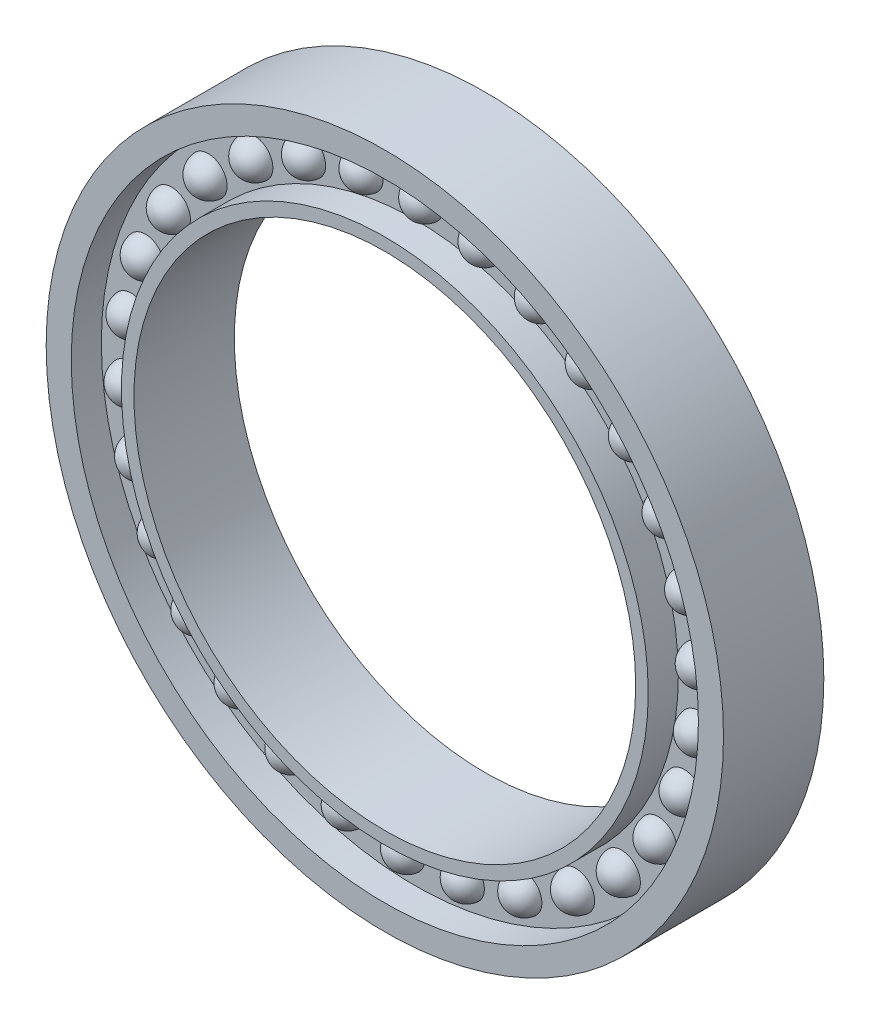
from build123d import *

# Parameters (mm, degrees)
SKETCH_1_R                       = 13.5
SKETCH_1_R_2                     = 10
EXTRUDE_1_DEPTH                  = 2
SKETCH_2_R                       = 12.5
SKETCH_2_R_2                     = 10.5
CUT_EXTRUDE_1_DEPTH              = 1.2
SKETCH_4_R                       = 0.75
EXTRUDE_2_DEPTH                  = 1.5
FILLET_1_R                       = 0.75
FILLET_2_R                       = 0.75
PATTERN_CIRCULAR_2_COUNT         = 30
FILLET_1_OF_PATTERN_CIRCULAR_2_R = 0.75
FILLET_2_OF_PATTERN_CIRCULAR_2_R = 0.75


with BuildPart() as part:
    # 草图1 → 凸台-拉伸1 (new, symmetric)
    with BuildSketch(Plane.XY):
        Circle(SKETCH_1_R)
        Circle(SKETCH_1_R_2, mode=Mode.SUBTRACT)
    extrude(amount=EXTRUDE_1_DEPTH, both=True)

    # 草图2 → 切除-拉伸1 (cut)
    with BuildSketch(Plane.XY.offset(2)):
        Circle(SKETCH_2_R)
        Circle(SKETCH_2_R_2, mode=Mode.SUBTRACT)
    cut_extrude_1 = extrude(amount=-CUT_EXTRUDE_1_DEPTH, mode=Mode.SUBTRACT)

    # 镜向1: 切除-拉伸1 across plane
    add(cut_extrude_1.mirror(Plane.XY), mode=Mode.SUBTRACT)

    # 草图4 → 凸台-拉伸2 (add, symmetric)
    with BuildSketch(Plane.XY):
        with Locations(Location((0.362190159, 11.409269929, 0), (0, 0, 180))):
            Circle(SKETCH_4_R)
    extrude_2 = extrude(amount=EXTRUDE_2_DEPTH, both=True)

    # 圆角1
    # the kernel refuses this fillet: 0.75 mm, written as the material it takes off along each edge
    with BuildSketch(Plane(origin=(0.362190159, 11.409269929, 1.5), x_dir=(-1, 0, 0), z_dir=(0, 1, 0))) as fillet_1_piece_1:
        with BuildLine():
            CenterArc((0.001668523, -0.75), FILLET_1_R, 3.822553729, 86.177446271)
            Line((0.001668523, 0), (0.001668523, 0.015))
            Line((0.001668523, 0.015), (0.75, 0.015))
            Line((0.75, 0.015), (0.765, 0))
            ThreePointArc((0.765, 0), (0.765, -0.35), (0.76496663, -0.699))
            Line((0.76496663, -0.699), (0.75, -0.7))
        make_face()
    revolve(axis=Axis((0.362190159, 11.409269929, 1.5), (0, 0, 1)), mode=Mode.SUBTRACT)

    # 圆角2
    # the kernel refuses this fillet: 0.75 mm, written as the material it takes off along each edge
    with BuildSketch(Plane(origin=(0.362190159, 11.409269929, -1.5), x_dir=(-1, 0, 0), z_dir=(0, 1, 0))) as fillet_2_piece_1:
        with BuildLine():
            CenterArc((0.001668523, 0.75), FILLET_2_R, 270, 86.177446271)
            Line((0.001668523, 0), (0.001668523, -0.015))
            Line((0.001668523, -0.015), (0.75, -0.015))
            Line((0.75, -0.015), (0.765, 0))
            ThreePointArc((0.765, 0), (0.765, 0.35), (0.76496663, 0.699))
            Line((0.76496663, 0.699), (0.75, 0.7))
        make_face()
    revolve(axis=Axis((0.362190159, 11.409269929, -1.5), (0, 0, 1)), mode=Mode.SUBTRACT)

    # 阵列(圆周)2: 凸台-拉伸2 ×30 about axis
    pattern_circular_2_axis = Axis((0, 0, 0), (0, 0, 1))
    for i in range(1, PATTERN_CIRCULAR_2_COUNT):
        add(extrude_2.rotate(pattern_circular_2_axis, i * 360 / PATTERN_CIRCULAR_2_COUNT))

    # 圆角1 of 阵列(圆周)2
    # the kernel refuses this fillet: 0.75 mm, written as the material it takes off along each edge
    with BuildSketch(Plane(origin=(-2.017845167, 11.235253576, 1.5), x_dir=(-0.9781476007338056, -0.20791169081775945, 0), z_dir=(-0.20791169081775945, 0.9781476007338056, 0))) as fillet_1_of_pattern_circular_2_piece_1:
        with BuildLine():
            CenterArc((0.001668523, -0.75), FILLET_1_OF_PATTERN_CIRCULAR_2_R, 3.822553729, 86.177446271)
            Line((0.001668523, 0), (0.001668523, 0.015))
            Line((0.001668523, 0.015), (0.75, 0.015))
            Line((0.75, 0.015), (0.765, 0))
            ThreePointArc((0.765, 0), (0.765, -0.35), (0.76496663, -0.699))
            Line((0.76496663, -0.699), (0.75, -0.7))
        make_face()
    revolve(axis=Axis((-2.017845167, 11.235253576, 1.5), (0, 0, 1)), mode=Mode.SUBTRACT)
    with BuildSketch(Plane(origin=(-4.309690977, 10.570202728, 1.5), x_dir=(-0.9135454576426008, -0.4067366430758004, 0), z_dir=(-0.4067366430758004, 0.9135454576426008, 0))) as fillet_1_of_pattern_circular_2_piece_2:
        with BuildLine():
            CenterArc((0.001668523, -0.75), FILLET_1_OF_PATTERN_CIRCULAR_2_R, 3.822553729, 86.177446271)
            Line((0.001668523, 0), (0.001668523, 0.015))
            Line((0.001668523, 0.015), (0.75, 0.015))
            Line((0.75, 0.015), (0.765, 0))
            ThreePointArc((0.765, 0), (0.765, -0.35), (0.76496663, -0.699))
            Line((0.76496663, -0.699), (0.75, -0.7))
        make_face()
    revolve(axis=Axis((-4.309690977, 10.570202728, 1.5), (0, 0, 1)), mode=Mode.SUBTRACT)
    with BuildSketch(Plane(origin=(-6.41318261, 9.4431833, 1.5), x_dir=(-0.809016994374948, -0.5877852522924724, 0), z_dir=(-0.5877852522924724, 0.809016994374948, 0))) as fillet_1_of_pattern_circular_2_piece_3:
        with BuildLine():
            CenterArc((0.001668523, -0.75), FILLET_1_OF_PATTERN_CIRCULAR_2_R, 3.822553729, 86.177446271)
            Line((0.001668523, 0), (0.001668523, 0.015))
            Line((0.001668523, 0.015), (0.75, 0.015))
            Line((0.75, 0.015), (0.765, 0))
            ThreePointArc((0.765, 0), (0.765, -0.35), (0.76496663, -0.699))
            Line((0.76496663, -0.699), (0.75, -0.7))
        make_face()
    revolve(axis=Axis((-6.41318261, 9.4431833, 1.5), (0, 0, 1)), mode=Mode.SUBTRACT)
    with BuildSketch(Plane(origin=(-8.23638739, 7.903451448, 1.5), x_dir=(-0.6691306063588581, -0.7431448254773942, 0), z_dir=(-0.7431448254773942, 0.6691306063588581, 0))) as fillet_1_of_pattern_circular_2_piece_4:
        with BuildLine():
            CenterArc((0.001668523, -0.75), FILLET_1_OF_PATTERN_CIRCULAR_2_R, 3.822553729, 86.177446271)
            Line((0.001668523, 0), (0.001668523, 0.015))
            Line((0.001668523, 0.015), (0.75, 0.015))
            Line((0.75, 0.015), (0.765, 0))
            ThreePointArc((0.765, 0), (0.765, -0.35), (0.76496663, -0.699))
            Line((0.76496663, -0.699), (0.75, -0.7))
        make_face()
    revolve(axis=Axis((-8.23638739, 7.903451448, 1.5), (0, 0, 1)), mode=Mode.SUBTRACT)
    with BuildSketch(Plane(origin=(-9.699622518, 6.018300843, 1.5), x_dir=(-0.5, -0.8660254037844387, 0), z_dir=(-0.8660254037844387, 0.5, 0))) as fillet_1_of_pattern_circular_2_piece_5:
        with BuildLine():
            CenterArc((0.001668523, -0.75), FILLET_1_OF_PATTERN_CIRCULAR_2_R, 3.822553729, 86.177446271)
            Line((0.001668523, 0), (0.001668523, 0.015))
            Line((0.001668523, 0.015), (0.75, 0.015))
            Line((0.75, 0.015), (0.765, 0))
            ThreePointArc((0.765, 0), (0.765, -0.35), (0.76496663, -0.699))
            Line((0.76496663, -0.699), (0.75, -0.7))
        make_face()
    revolve(axis=Axis((-9.699622518, 6.018300843, 1.5), (0, 0, 1)), mode=Mode.SUBTRACT)
    with BuildSketch(Plane(origin=(-10.738937598, 3.870121612, 1.5), x_dir=(-0.30901699437494773, -0.9510565162951535, 0), z_dir=(-0.9510565162951535, 0.30901699437494773, 0))) as fillet_1_of_pattern_circular_2_piece_6:
        with BuildLine():
            CenterArc((0.001668523, -0.75), FILLET_1_OF_PATTERN_CIRCULAR_2_R, 3.822553729, 86.177446271)
            Line((0.001668523, 0), (0.001668523, 0.015))
            Line((0.001668523, 0.015), (0.75, 0.015))
            Line((0.75, 0.015), (0.765, 0))
            ThreePointArc((0.765, 0), (0.765, -0.35), (0.76496663, -0.699))
            Line((0.76496663, -0.699), (0.75, -0.7))
        make_face()
    revolve(axis=Axis((-10.738937598, 3.870121612, 1.5), (0, 0, 1)), mode=Mode.SUBTRACT)
    with BuildSketch(Plane(origin=(-11.308909574, 1.552799496, 1.5), x_dir=(-0.10452846326765311, -0.9945218953682734, 0), z_dir=(-0.9945218953682734, 0.10452846326765311, 0))) as fillet_1_of_pattern_circular_2_piece_7:
        with BuildLine():
            CenterArc((0.001668523, -0.75), FILLET_1_OF_PATTERN_CIRCULAR_2_R, 3.822553729, 86.177446271)
            Line((0.001668523, 0), (0.001668523, 0.015))
            Line((0.001668523, 0.015), (0.75, 0.015))
            Line((0.75, 0.015), (0.765, 0))
            ThreePointArc((0.765, 0), (0.765, -0.35), (0.76496663, -0.699))
            Line((0.76496663, -0.699), (0.75, -0.7))
        make_face()
    revolve(axis=Axis((-11.308909574, 1.552799496, 1.5), (0, 0, 1)), mode=Mode.SUBTRACT)
    with BuildSketch(Plane(origin=(-11.384627935, -0.83238741, 1.5), x_dir=(0.10452846326765312, -0.9945218953682734, 0), z_dir=(-0.9945218953682734, -0.10452846326765312, 0))) as fillet_1_of_pattern_circular_2_piece_8:
        with BuildLine():
            CenterArc((0.001668523, -0.75), FILLET_1_OF_PATTERN_CIRCULAR_2_R, 3.822553729, 86.177446271)
            Line((0.001668523, 0), (0.001668523, 0.015))
            Line((0.001668523, 0.015), (0.75, 0.015))
            Line((0.75, 0.015), (0.765, 0))
            ThreePointArc((0.765, 0), (0.765, -0.35), (0.76496663, -0.699))
            Line((0.76496663, -0.699), (0.75, -0.7))
        make_face()
    revolve(axis=Axis((-11.384627935, -0.83238741, 1.5), (0, 0, 1)), mode=Mode.SUBTRACT)
    with BuildSketch(Plane(origin=(-10.962783426, -3.181194991, 1.5), x_dir=(0.3090169943749475, -0.9510565162951535, 0), z_dir=(-0.9510565162951535, -0.3090169943749475, 0))) as fillet_1_of_pattern_circular_2_piece_9:
        with BuildLine():
            CenterArc((0.001668523, -0.75), FILLET_1_OF_PATTERN_CIRCULAR_2_R, 3.822553729, 86.177446271)
            Line((0.001668523, 0), (0.001668523, 0.015))
            Line((0.001668523, 0.015), (0.75, 0.015))
            Line((0.75, 0.015), (0.765, 0))
            ThreePointArc((0.765, 0), (0.765, -0.35), (0.76496663, -0.699))
            Line((0.76496663, -0.699), (0.75, -0.7))
        make_face()
    revolve(axis=Axis((-10.962783426, -3.181194991, 1.5), (0, 0, 1)), mode=Mode.SUBTRACT)
    with BuildSketch(Plane(origin=(-10.061812677, -5.390969086, 1.5), x_dir=(0.5, -0.8660254037844387, 0), z_dir=(-0.8660254037844387, -0.5, 0))) as fillet_1_of_pattern_circular_2_piece_10:
        with BuildLine():
            CenterArc((0.001668523, -0.75), FILLET_1_OF_PATTERN_CIRCULAR_2_R, 3.822553729, 86.177446271)
            Line((0.001668523, 0), (0.001668523, 0.015))
            Line((0.001668523, 0.015), (0.75, 0.015))
            Line((0.75, 0.015), (0.765, 0))
            ThreePointArc((0.765, 0), (0.765, -0.35), (0.76496663, -0.699))
            Line((0.76496663, -0.699), (0.75, -0.7))
        make_face()
    revolve(axis=Axis((-10.061812677, -5.390969086, 1.5), (0, 0, 1)), mode=Mode.SUBTRACT)
    with BuildSketch(Plane(origin=(-8.721092431, -7.365131964, 1.5), x_dir=(0.6691306063588581, -0.7431448254773942, 0), z_dir=(-0.7431448254773942, -0.6691306063588581, 0))) as fillet_1_of_pattern_circular_2_piece_11:
        with BuildLine():
            CenterArc((0.001668523, -0.75), FILLET_1_OF_PATTERN_CIRCULAR_2_R, 3.822553729, 86.177446271)
            Line((0.001668523, 0), (0.001668523, 0.015))
            Line((0.001668523, 0.015), (0.75, 0.015))
            Line((0.75, 0.015), (0.765, 0))
            ThreePointArc((0.765, 0), (0.765, -0.35), (0.76496663, -0.699))
            Line((0.76496663, -0.699), (0.75, -0.7))
        make_face()
    revolve(axis=Axis((-8.721092431, -7.365131964, 1.5), (0, 0, 1)), mode=Mode.SUBTRACT)
    with BuildSketch(Plane(origin=(-6.999218597, -9.017403232, 1.5), x_dir=(0.809016994374948, -0.5877852522924724, 0), z_dir=(-0.5877852522924724, -0.809016994374948, 0))) as fillet_1_of_pattern_circular_2_piece_12:
        with BuildLine():
            CenterArc((0.001668523, -0.75), FILLET_1_OF_PATTERN_CIRCULAR_2_R, 3.822553729, 86.177446271)
            Line((0.001668523, 0), (0.001668523, 0.015))
            Line((0.001668523, 0.015), (0.75, 0.015))
            Line((0.75, 0.015), (0.765, 0))
            ThreePointArc((0.765, 0), (0.765, -0.35), (0.76496663, -0.699))
            Line((0.76496663, -0.699), (0.75, -0.7))
        make_face()
    revolve(axis=Axis((-6.999218597, -9.017403232, 1.5), (0, 0, 1)), mode=Mode.SUBTRACT)
    with BuildSketch(Plane(origin=(-4.971445325, -10.275570709, 1.5), x_dir=(0.9135454576426008, -0.4067366430758004, 0), z_dir=(-0.4067366430758004, -0.9135454576426008, 0))) as fillet_1_of_pattern_circular_2_piece_13:
        with BuildLine():
            CenterArc((0.001668523, -0.75), FILLET_1_OF_PATTERN_CIRCULAR_2_R, 3.822553729, 86.177446271)
            Line((0.001668523, 0), (0.001668523, 0.015))
            Line((0.001668523, 0.015), (0.75, 0.015))
            Line((0.75, 0.015), (0.765, 0))
            ThreePointArc((0.765, 0), (0.765, -0.35), (0.76496663, -0.699))
            Line((0.76496663, -0.699), (0.75, -0.7))
        make_face()
    revolve(axis=Axis((-4.971445325, -10.275570709, 1.5), (0, 0, 1)), mode=Mode.SUBTRACT)
    with BuildSketch(Plane(origin=(-2.726396037, -11.084646439, 1.5), x_dir=(0.9781476007338056, -0.20791169081775954, 0), z_dir=(-0.20791169081775954, -0.9781476007338056, 0))) as fillet_1_of_pattern_circular_2_piece_14:
        with BuildLine():
            CenterArc((0.001668523, -0.75), FILLET_1_OF_PATTERN_CIRCULAR_2_R, 3.822553729, 86.177446271)
            Line((0.001668523, 0), (0.001668523, 0.015))
            Line((0.001668523, 0.015), (0.75, 0.015))
            Line((0.75, 0.015), (0.765, 0))
            ThreePointArc((0.765, 0), (0.765, -0.35), (0.76496663, -0.699))
            Line((0.76496663, -0.699), (0.75, -0.7))
        make_face()
    revolve(axis=Axis((-2.726396037, -11.084646439, 1.5), (0, 0, 1)), mode=Mode.SUBTRACT)
    with BuildSketch(Plane(origin=(-0.362190159, -11.409269929, 1.5), x_dir=(1, 0, 0), z_dir=(0, -1, 0))) as fillet_1_of_pattern_circular_2_piece_15:
        with BuildLine():
            CenterArc((0.001668523, -0.75), FILLET_1_OF_PATTERN_CIRCULAR_2_R, 3.822553729, 86.177446271)
            Line((0.001668523, 0), (0.001668523, 0.015))
            Line((0.001668523, 0.015), (0.75, 0.015))
            Line((0.75, 0.015), (0.765, 0))
            ThreePointArc((0.765, 0), (0.765, -0.35), (0.76496663, -0.699))
            Line((0.76496663, -0.699), (0.75, -0.7))
        make_face()
    revolve(axis=Axis((-0.362190159, -11.409269929, 1.5), (0, 0, 1)), mode=Mode.SUBTRACT)
    with BuildSketch(Plane(origin=(2.017845167, -11.235253576, 1.5), x_dir=(0.9781476007338056, 0.20791169081775945, 0), z_dir=(0.20791169081775945, -0.9781476007338056, 0))) as fillet_1_of_pattern_circular_2_piece_16:
        with BuildLine():
            CenterArc((0.001668523, -0.75), FILLET_1_OF_PATTERN_CIRCULAR_2_R, 3.822553729, 86.177446271)
            Line((0.001668523, 0), (0.001668523, 0.015))
            Line((0.001668523, 0.015), (0.75, 0.015))
            Line((0.75, 0.015), (0.765, 0))
            ThreePointArc((0.765, 0), (0.765, -0.35), (0.76496663, -0.699))
            Line((0.76496663, -0.699), (0.75, -0.7))
        make_face()
    revolve(axis=Axis((2.017845167, -11.235253576, 1.5), (0, 0, 1)), mode=Mode.SUBTRACT)
    with BuildSketch(Plane(origin=(4.309690977, -10.570202728, 1.5), x_dir=(0.9135454576426008, 0.4067366430758004, 0), z_dir=(0.4067366430758004, -0.9135454576426008, 0))) as fillet_1_of_pattern_circular_2_piece_17:
        with BuildLine():
            CenterArc((0.001668523, -0.75), FILLET_1_OF_PATTERN_CIRCULAR_2_R, 3.822553729, 86.177446271)
            Line((0.001668523, 0), (0.001668523, 0.015))
            Line((0.001668523, 0.015), (0.75, 0.015))
            Line((0.75, 0.015), (0.765, 0))
            ThreePointArc((0.765, 0), (0.765, -0.35), (0.76496663, -0.699))
            Line((0.76496663, -0.699), (0.75, -0.7))
        make_face()
    revolve(axis=Axis((4.309690977, -10.570202728, 1.5), (0, 0, 1)), mode=Mode.SUBTRACT)
    with BuildSketch(Plane(origin=(6.41318261, -9.4431833, 1.5), x_dir=(0.809016994374948, 0.5877852522924724, 0), z_dir=(0.5877852522924724, -0.809016994374948, 0))) as fillet_1_of_pattern_circular_2_piece_18:
        with BuildLine():
            CenterArc((0.001668523, -0.75), FILLET_1_OF_PATTERN_CIRCULAR_2_R, 3.822553729, 86.177446271)
            Line((0.001668523, 0), (0.001668523, 0.015))
            Line((0.001668523, 0.015), (0.75, 0.015))
            Line((0.75, 0.015), (0.765, 0))
            ThreePointArc((0.765, 0), (0.765, -0.35), (0.76496663, -0.699))
            Line((0.76496663, -0.699), (0.75, -0.7))
        make_face()
    revolve(axis=Axis((6.41318261, -9.4431833, 1.5), (0, 0, 1)), mode=Mode.SUBTRACT)
    with BuildSketch(Plane(origin=(8.23638739, -7.903451448, 1.5), x_dir=(0.6691306063588581, 0.7431448254773942, 0), z_dir=(0.7431448254773942, -0.6691306063588581, 0))) as fillet_1_of_pattern_circular_2_piece_19:
        with BuildLine():
            CenterArc((0.001668523, -0.75), FILLET_1_OF_PATTERN_CIRCULAR_2_R, 3.822553729, 86.177446271)
            Line((0.001668523, 0), (0.001668523, 0.015))
            Line((0.001668523, 0.015), (0.75, 0.015))
            Line((0.75, 0.015), (0.765, 0))
            ThreePointArc((0.765, 0), (0.765, -0.35), (0.76496663, -0.699))
            Line((0.76496663, -0.699), (0.75, -0.7))
        make_face()
    revolve(axis=Axis((8.23638739, -7.903451448, 1.5), (0, 0, 1)), mode=Mode.SUBTRACT)
    with BuildSketch(Plane(origin=(9.699622518, -6.018300843, 1.5), x_dir=(0.5000000000000018, 0.8660254037844376, 0), z_dir=(0.8660254037844376, -0.5000000000000018, 0))) as fillet_1_of_pattern_circular_2_piece_20:
        with BuildLine():
            CenterArc((0.001668523, -0.75), FILLET_1_OF_PATTERN_CIRCULAR_2_R, 3.822553729, 86.177446271)
            Line((0.001668523, 0), (0.001668523, 0.015))
            Line((0.001668523, 0.015), (0.75, 0.015))
            Line((0.75, 0.015), (0.765, 0))
            ThreePointArc((0.765, 0), (0.765, -0.35), (0.76496663, -0.699))
            Line((0.76496663, -0.699), (0.75, -0.7))
        make_face()
    revolve(axis=Axis((9.699622518, -6.018300843, 1.5), (0, 0, 1)), mode=Mode.SUBTRACT)
    with BuildSketch(Plane(origin=(10.738937598, -3.870121612, 1.5), x_dir=(0.30901699437494773, 0.9510565162951535, 0), z_dir=(0.9510565162951535, -0.30901699437494773, 0))) as fillet_1_of_pattern_circular_2_piece_21:
        with BuildLine():
            CenterArc((0.001668523, -0.75), FILLET_1_OF_PATTERN_CIRCULAR_2_R, 3.822553729, 86.177446271)
            Line((0.001668523, 0), (0.001668523, 0.015))
            Line((0.001668523, 0.015), (0.75, 0.015))
            Line((0.75, 0.015), (0.765, 0))
            ThreePointArc((0.765, 0), (0.765, -0.35), (0.76496663, -0.699))
            Line((0.76496663, -0.699), (0.75, -0.7))
        make_face()
    revolve(axis=Axis((10.738937598, -3.870121612, 1.5), (0, 0, 1)), mode=Mode.SUBTRACT)
    with BuildSketch(Plane(origin=(11.308909574, -1.552799496, 1.5), x_dir=(0.1045284632676531, 0.9945218953682734, 0), z_dir=(0.9945218953682734, -0.1045284632676531, 0))) as fillet_1_of_pattern_circular_2_piece_22:
        with BuildLine():
            CenterArc((0.001668523, -0.75), FILLET_1_OF_PATTERN_CIRCULAR_2_R, 3.822553729, 86.177446271)
            Line((0.001668523, 0), (0.001668523, 0.015))
            Line((0.001668523, 0.015), (0.75, 0.015))
            Line((0.75, 0.015), (0.765, 0))
            ThreePointArc((0.765, 0), (0.765, -0.35), (0.76496663, -0.699))
            Line((0.76496663, -0.699), (0.75, -0.7))
        make_face()
    revolve(axis=Axis((11.308909574, -1.552799496, 1.5), (0, 0, 1)), mode=Mode.SUBTRACT)
    with BuildSketch(Plane(origin=(11.384627935, 0.83238741, 1.5), x_dir=(-0.1045284632676531, 0.9945218953682734, 0), z_dir=(0.9945218953682734, 0.1045284632676531, 0))) as fillet_1_of_pattern_circular_2_piece_23:
        with BuildLine():
            CenterArc((0.001668523, -0.75), FILLET_1_OF_PATTERN_CIRCULAR_2_R, 3.822553729, 86.177446271)
            Line((0.001668523, 0), (0.001668523, 0.015))
            Line((0.001668523, 0.015), (0.75, 0.015))
            Line((0.75, 0.015), (0.765, 0))
            ThreePointArc((0.765, 0), (0.765, -0.35), (0.76496663, -0.699))
            Line((0.76496663, -0.699), (0.75, -0.7))
        make_face()
    revolve(axis=Axis((11.384627935, 0.83238741, 1.5), (0, 0, 1)), mode=Mode.SUBTRACT)
    with BuildSketch(Plane(origin=(10.962783426, 3.181194991, 1.5), x_dir=(-0.3090169943749475, 0.9510565162951535, 0), z_dir=(0.9510565162951535, 0.3090169943749475, 0))) as fillet_1_of_pattern_circular_2_piece_24:
        with BuildLine():
            CenterArc((0.001668523, -0.75), FILLET_1_OF_PATTERN_CIRCULAR_2_R, 3.822553729, 86.177446271)
            Line((0.001668523, 0), (0.001668523, 0.015))
            Line((0.001668523, 0.015), (0.75, 0.015))
            Line((0.75, 0.015), (0.765, 0))
            ThreePointArc((0.765, 0), (0.765, -0.35), (0.76496663, -0.699))
            Line((0.76496663, -0.699), (0.75, -0.7))
        make_face()
    revolve(axis=Axis((10.962783426, 3.181194991, 1.5), (0, 0, 1)), mode=Mode.SUBTRACT)
    with BuildSketch(Plane(origin=(10.061812677, 5.390969086, 1.5), x_dir=(-0.5, 0.8660254037844387, 0), z_dir=(0.8660254037844387, 0.5, 0))) as fillet_1_of_pattern_circular_2_piece_25:
        with BuildLine():
            CenterArc((0.001668523, -0.75), FILLET_1_OF_PATTERN_CIRCULAR_2_R, 3.822553729, 86.177446271)
            Line((0.001668523, 0), (0.001668523, 0.015))
            Line((0.001668523, 0.015), (0.75, 0.015))
            Line((0.75, 0.015), (0.765, 0))
            ThreePointArc((0.765, 0), (0.765, -0.35), (0.76496663, -0.699))
            Line((0.76496663, -0.699), (0.75, -0.7))
        make_face()
    revolve(axis=Axis((10.061812677, 5.390969086, 1.5), (0, 0, 1)), mode=Mode.SUBTRACT)
    with BuildSketch(Plane(origin=(8.721092431, 7.365131964, 1.5), x_dir=(-0.6691306063588576, 0.7431448254773948, 0), z_dir=(0.7431448254773948, 0.6691306063588576, 0))) as fillet_1_of_pattern_circular_2_piece_26:
        with BuildLine():
            CenterArc((0.001668523, -0.75), FILLET_1_OF_PATTERN_CIRCULAR_2_R, 3.822553729, 86.177446271)
            Line((0.001668523, 0), (0.001668523, 0.015))
            Line((0.001668523, 0.015), (0.75, 0.015))
            Line((0.75, 0.015), (0.765, 0))
            ThreePointArc((0.765, 0), (0.765, -0.35), (0.76496663, -0.699))
            Line((0.76496663, -0.699), (0.75, -0.7))
        make_face()
    revolve(axis=Axis((8.721092431, 7.365131964, 1.5), (0, 0, 1)), mode=Mode.SUBTRACT)
    with BuildSketch(Plane(origin=(6.999218597, 9.017403232, 1.5), x_dir=(-0.809016994374948, 0.5877852522924724, 0), z_dir=(0.5877852522924724, 0.809016994374948, 0))) as fillet_1_of_pattern_circular_2_piece_27:
        with BuildLine():
            CenterArc((0.001668523, -0.75), FILLET_1_OF_PATTERN_CIRCULAR_2_R, 3.822553729, 86.177446271)
            Line((0.001668523, 0), (0.001668523, 0.015))
            Line((0.001668523, 0.015), (0.75, 0.015))
            Line((0.75, 0.015), (0.765, 0))
            ThreePointArc((0.765, 0), (0.765, -0.35), (0.76496663, -0.699))
            Line((0.76496663, -0.699), (0.75, -0.7))
        make_face()
    revolve(axis=Axis((6.999218597, 9.017403232, 1.5), (0, 0, 1)), mode=Mode.SUBTRACT)
    with BuildSketch(Plane(origin=(4.971445325, 10.275570709, 1.5), x_dir=(-0.9135454576426008, 0.4067366430758004, 0), z_dir=(0.4067366430758004, 0.9135454576426008, 0))) as fillet_1_of_pattern_circular_2_piece_28:
        with BuildLine():
            CenterArc((0.001668523, -0.75), FILLET_1_OF_PATTERN_CIRCULAR_2_R, 3.822553729, 86.177446271)
            Line((0.001668523, 0), (0.001668523, 0.015))
            Line((0.001668523, 0.015), (0.75, 0.015))
            Line((0.75, 0.015), (0.765, 0))
            ThreePointArc((0.765, 0), (0.765, -0.35), (0.76496663, -0.699))
            Line((0.76496663, -0.699), (0.75, -0.7))
        make_face()
    revolve(axis=Axis((4.971445325, 10.275570709, 1.5), (0, 0, 1)), mode=Mode.SUBTRACT)
    with BuildSketch(Plane(origin=(2.726396037, 11.084646439, 1.5), x_dir=(-0.9781476007338056, 0.20791169081775954, 0), z_dir=(0.20791169081775954, 0.9781476007338056, 0))) as fillet_1_of_pattern_circular_2_piece_29:
        with BuildLine():
            CenterArc((0.001668523, -0.75), FILLET_1_OF_PATTERN_CIRCULAR_2_R, 3.822553729, 86.177446271)
            Line((0.001668523, 0), (0.001668523, 0.015))
            Line((0.001668523, 0.015), (0.75, 0.015))
            Line((0.75, 0.015), (0.765, 0))
            ThreePointArc((0.765, 0), (0.765, -0.35), (0.76496663, -0.699))
            Line((0.76496663, -0.699), (0.75, -0.7))
        make_face()
    revolve(axis=Axis((2.726396037, 11.084646439, 1.5), (0, 0, 1)), mode=Mode.SUBTRACT)

    # 圆角2 of 阵列(圆周)2
    # the kernel refuses this fillet: 0.75 mm, written as the material it takes off along each edge
    with BuildSketch(Plane(origin=(-2.017845167, 11.235253576, -1.5), x_dir=(-0.9781476007338056, -0.20791169081775945, 0), z_dir=(-0.20791169081775945, 0.9781476007338056, 0))) as fillet_2_of_pattern_circular_2_piece_1:
        with BuildLine():
            CenterArc((0.001668523, 0.75), FILLET_2_OF_PATTERN_CIRCULAR_2_R, 270, 86.177446271)
            Line((0.001668523, 0), (0.001668523, -0.015))
            Line((0.001668523, -0.015), (0.75, -0.015))
            Line((0.75, -0.015), (0.765, 0))
            ThreePointArc((0.765, 0), (0.765, 0.35), (0.76496663, 0.699))
            Line((0.76496663, 0.699), (0.75, 0.7))
        make_face()
    revolve(axis=Axis((-2.017845167, 11.235253576, -1.5), (0, 0, 1)), mode=Mode.SUBTRACT)
    with BuildSketch(Plane(origin=(-4.309690977, 10.570202728, -1.5), x_dir=(-0.913545457642601, -0.4067366430758, 0), z_dir=(-0.4067366430758, 0.913545457642601, 0))) as fillet_2_of_pattern_circular_2_piece_2:
        with BuildLine():
            CenterArc((0.001668523, 0.75), FILLET_2_OF_PATTERN_CIRCULAR_2_R, 270, 86.177446271)
            Line((0.001668523, 0), (0.001668523, -0.015))
            Line((0.001668523, -0.015), (0.75, -0.015))
            Line((0.75, -0.015), (0.765, 0))
            ThreePointArc((0.765, 0), (0.765, 0.35), (0.76496663, 0.699))
            Line((0.76496663, 0.699), (0.75, 0.7))
        make_face()
    revolve(axis=Axis((-4.309690977, 10.570202728, -1.5), (0, 0, 1)), mode=Mode.SUBTRACT)
    with BuildSketch(Plane(origin=(-6.41318261, 9.4431833, -1.5), x_dir=(-0.809016994374948, -0.5877852522924724, 0), z_dir=(-0.5877852522924724, 0.809016994374948, 0))) as fillet_2_of_pattern_circular_2_piece_3:
        with BuildLine():
            CenterArc((0.001668523, 0.75), FILLET_2_OF_PATTERN_CIRCULAR_2_R, 270, 86.177446271)
            Line((0.001668523, 0), (0.001668523, -0.015))
            Line((0.001668523, -0.015), (0.75, -0.015))
            Line((0.75, -0.015), (0.765, 0))
            ThreePointArc((0.765, 0), (0.765, 0.35), (0.76496663, 0.699))
            Line((0.76496663, 0.699), (0.75, 0.7))
        make_face()
    revolve(axis=Axis((-6.41318261, 9.4431833, -1.5), (0, 0, 1)), mode=Mode.SUBTRACT)
    with BuildSketch(Plane(origin=(-8.23638739, 7.903451448, -1.5), x_dir=(-0.6691306063588581, -0.7431448254773942, 0), z_dir=(-0.7431448254773942, 0.6691306063588581, 0))) as fillet_2_of_pattern_circular_2_piece_4:
        with BuildLine():
            CenterArc((0.001668523, 0.75), FILLET_2_OF_PATTERN_CIRCULAR_2_R, 270, 86.177446271)
            Line((0.001668523, 0), (0.001668523, -0.015))
            Line((0.001668523, -0.015), (0.75, -0.015))
            Line((0.75, -0.015), (0.765, 0))
            ThreePointArc((0.765, 0), (0.765, 0.35), (0.76496663, 0.699))
            Line((0.76496663, 0.699), (0.75, 0.7))
        make_face()
    revolve(axis=Axis((-8.23638739, 7.903451448, -1.5), (0, 0, 1)), mode=Mode.SUBTRACT)
    with BuildSketch(Plane(origin=(-9.699622518, 6.018300843, -1.5), x_dir=(-0.5, -0.8660254037844387, 0), z_dir=(-0.8660254037844387, 0.5, 0))) as fillet_2_of_pattern_circular_2_piece_5:
        with BuildLine():
            CenterArc((0.001668523, 0.75), FILLET_2_OF_PATTERN_CIRCULAR_2_R, 270, 86.177446271)
            Line((0.001668523, 0), (0.001668523, -0.015))
            Line((0.001668523, -0.015), (0.75, -0.015))
            Line((0.75, -0.015), (0.765, 0))
            ThreePointArc((0.765, 0), (0.765, 0.35), (0.76496663, 0.699))
            Line((0.76496663, 0.699), (0.75, 0.7))
        make_face()
    revolve(axis=Axis((-9.699622518, 6.018300843, -1.5), (0, 0, 1)), mode=Mode.SUBTRACT)
    with BuildSketch(Plane(origin=(-10.738937598, 3.870121612, -1.5), x_dir=(-0.30901699437494773, -0.9510565162951535, 0), z_dir=(-0.9510565162951535, 0.30901699437494773, 0))) as fillet_2_of_pattern_circular_2_piece_6:
        with BuildLine():
            CenterArc((0.001668523, 0.75), FILLET_2_OF_PATTERN_CIRCULAR_2_R, 270, 86.177446271)
            Line((0.001668523, 0), (0.001668523, -0.015))
            Line((0.001668523, -0.015), (0.75, -0.015))
            Line((0.75, -0.015), (0.765, 0))
            ThreePointArc((0.765, 0), (0.765, 0.35), (0.76496663, 0.699))
            Line((0.76496663, 0.699), (0.75, 0.7))
        make_face()
    revolve(axis=Axis((-10.738937598, 3.870121612, -1.5), (0, 0, 1)), mode=Mode.SUBTRACT)
    with BuildSketch(Plane(origin=(-11.308909574, 1.552799496, -1.5), x_dir=(-0.10452846326765311, -0.9945218953682734, 0), z_dir=(-0.9945218953682734, 0.10452846326765311, 0))) as fillet_2_of_pattern_circular_2_piece_7:
        with BuildLine():
            CenterArc((0.001668523, 0.75), FILLET_2_OF_PATTERN_CIRCULAR_2_R, 270, 86.177446271)
            Line((0.001668523, 0), (0.001668523, -0.015))
            Line((0.001668523, -0.015), (0.75, -0.015))
            Line((0.75, -0.015), (0.765, 0))
            ThreePointArc((0.765, 0), (0.765, 0.35), (0.76496663, 0.699))
            Line((0.76496663, 0.699), (0.75, 0.7))
        make_face()
    revolve(axis=Axis((-11.308909574, 1.552799496, -1.5), (0, 0, 1)), mode=Mode.SUBTRACT)
    with BuildSketch(Plane(origin=(-11.384627935, -0.83238741, -1.5), x_dir=(0.10452846326765311, -0.9945218953682734, 0), z_dir=(-0.9945218953682734, -0.10452846326765311, 0))) as fillet_2_of_pattern_circular_2_piece_8:
        with BuildLine():
            CenterArc((0.001668523, 0.75), FILLET_2_OF_PATTERN_CIRCULAR_2_R, 270, 86.177446271)
            Line((0.001668523, 0), (0.001668523, -0.015))
            Line((0.001668523, -0.015), (0.75, -0.015))
            Line((0.75, -0.015), (0.765, 0))
            ThreePointArc((0.765, 0), (0.765, 0.35), (0.76496663, 0.699))
            Line((0.76496663, 0.699), (0.75, 0.7))
        make_face()
    revolve(axis=Axis((-11.384627935, -0.83238741, -1.5), (0, 0, 1)), mode=Mode.SUBTRACT)
    with BuildSketch(Plane(origin=(-10.962783426, -3.181194991, -1.5), x_dir=(0.3090169943749475, -0.9510565162951535, 0), z_dir=(-0.9510565162951535, -0.3090169943749475, 0))) as fillet_2_of_pattern_circular_2_piece_9:
        with BuildLine():
            CenterArc((0.001668523, 0.75), FILLET_2_OF_PATTERN_CIRCULAR_2_R, 270, 86.177446271)
            Line((0.001668523, 0), (0.001668523, -0.015))
            Line((0.001668523, -0.015), (0.75, -0.015))
            Line((0.75, -0.015), (0.765, 0))
            ThreePointArc((0.765, 0), (0.765, 0.35), (0.76496663, 0.699))
            Line((0.76496663, 0.699), (0.75, 0.7))
        make_face()
    revolve(axis=Axis((-10.962783426, -3.181194991, -1.5), (0, 0, 1)), mode=Mode.SUBTRACT)
    with BuildSketch(Plane(origin=(-10.061812677, -5.390969086, -1.5), x_dir=(0.5, -0.8660254037844387, 0), z_dir=(-0.8660254037844387, -0.5, 0))) as fillet_2_of_pattern_circular_2_piece_10:
        with BuildLine():
            CenterArc((0.001668523, 0.75), FILLET_2_OF_PATTERN_CIRCULAR_2_R, 270, 86.177446271)
            Line((0.001668523, 0), (0.001668523, -0.015))
            Line((0.001668523, -0.015), (0.75, -0.015))
            Line((0.75, -0.015), (0.765, 0))
            ThreePointArc((0.765, 0), (0.765, 0.35), (0.76496663, 0.699))
            Line((0.76496663, 0.699), (0.75, 0.7))
        make_face()
    revolve(axis=Axis((-10.061812677, -5.390969086, -1.5), (0, 0, 1)), mode=Mode.SUBTRACT)
    with BuildSketch(Plane(origin=(-8.721092431, -7.365131964, -1.5), x_dir=(0.6691306063588581, -0.7431448254773942, 0), z_dir=(-0.7431448254773942, -0.6691306063588581, 0))) as fillet_2_of_pattern_circular_2_piece_11:
        with BuildLine():
            CenterArc((0.001668523, 0.75), FILLET_2_OF_PATTERN_CIRCULAR_2_R, 270, 86.177446271)
            Line((0.001668523, 0), (0.001668523, -0.015))
            Line((0.001668523, -0.015), (0.75, -0.015))
            Line((0.75, -0.015), (0.765, 0))
            ThreePointArc((0.765, 0), (0.765, 0.35), (0.76496663, 0.699))
            Line((0.76496663, 0.699), (0.75, 0.7))
        make_face()
    revolve(axis=Axis((-8.721092431, -7.365131964, -1.5), (0, 0, 1)), mode=Mode.SUBTRACT)
    with BuildSketch(Plane(origin=(-6.999218597, -9.017403232, -1.5), x_dir=(0.809016994374948, -0.5877852522924724, 0), z_dir=(-0.5877852522924724, -0.809016994374948, 0))) as fillet_2_of_pattern_circular_2_piece_12:
        with BuildLine():
            CenterArc((0.001668523, 0.75), FILLET_2_OF_PATTERN_CIRCULAR_2_R, 270, 86.177446271)
            Line((0.001668523, 0), (0.001668523, -0.015))
            Line((0.001668523, -0.015), (0.75, -0.015))
            Line((0.75, -0.015), (0.765, 0))
            ThreePointArc((0.765, 0), (0.765, 0.35), (0.76496663, 0.699))
            Line((0.76496663, 0.699), (0.75, 0.7))
        make_face()
    revolve(axis=Axis((-6.999218597, -9.017403232, -1.5), (0, 0, 1)), mode=Mode.SUBTRACT)
    with BuildSketch(Plane(origin=(-4.971445325, -10.275570709, -1.5), x_dir=(0.9135454576426008, -0.4067366430758004, 0), z_dir=(-0.4067366430758004, -0.9135454576426008, 0))) as fillet_2_of_pattern_circular_2_piece_13:
        with BuildLine():
            CenterArc((0.001668523, 0.75), FILLET_2_OF_PATTERN_CIRCULAR_2_R, 270, 86.177446271)
            Line((0.001668523, 0), (0.001668523, -0.015))
            Line((0.001668523, -0.015), (0.75, -0.015))
            Line((0.75, -0.015), (0.765, 0))
            ThreePointArc((0.765, 0), (0.765, 0.35), (0.76496663, 0.699))
            Line((0.76496663, 0.699), (0.75, 0.7))
        make_face()
    revolve(axis=Axis((-4.971445325, -10.275570709, -1.5), (0, 0, 1)), mode=Mode.SUBTRACT)
    with BuildSketch(Plane(origin=(-2.726396037, -11.084646439, -1.5), x_dir=(0.9781476007338056, -0.20791169081775954, 0), z_dir=(-0.20791169081775954, -0.9781476007338056, 0))) as fillet_2_of_pattern_circular_2_piece_14:
        with BuildLine():
            CenterArc((0.001668523, 0.75), FILLET_2_OF_PATTERN_CIRCULAR_2_R, 270, 86.177446271)
            Line((0.001668523, 0), (0.001668523, -0.015))
            Line((0.001668523, -0.015), (0.75, -0.015))
            Line((0.75, -0.015), (0.765, 0))
            ThreePointArc((0.765, 0), (0.765, 0.35), (0.76496663, 0.699))
            Line((0.76496663, 0.699), (0.75, 0.7))
        make_face()
    revolve(axis=Axis((-2.726396037, -11.084646439, -1.5), (0, 0, 1)), mode=Mode.SUBTRACT)
    with BuildSketch(Plane(origin=(-0.362190159, -11.409269929, -1.5), x_dir=(1, 0, 0), z_dir=(0, -1, 0))) as fillet_2_of_pattern_circular_2_piece_15:
        with BuildLine():
            CenterArc((0.001668523, 0.75), FILLET_2_OF_PATTERN_CIRCULAR_2_R, 270, 86.177446271)
            Line((0.001668523, 0), (0.001668523, -0.015))
            Line((0.001668523, -0.015), (0.75, -0.015))
            Line((0.75, -0.015), (0.765, 0))
            ThreePointArc((0.765, 0), (0.765, 0.35), (0.76496663, 0.699))
            Line((0.76496663, 0.699), (0.75, 0.7))
        make_face()
    revolve(axis=Axis((-0.362190159, -11.409269929, -1.5), (0, 0, 1)), mode=Mode.SUBTRACT)
    with BuildSketch(Plane(origin=(2.017845167, -11.235253576, -1.5), x_dir=(0.9781476007338056, 0.20791169081775945, 0), z_dir=(0.20791169081775945, -0.9781476007338056, 0))) as fillet_2_of_pattern_circular_2_piece_16:
        with BuildLine():
            CenterArc((0.001668523, 0.75), FILLET_2_OF_PATTERN_CIRCULAR_2_R, 270, 86.177446271)
            Line((0.001668523, 0), (0.001668523, -0.015))
            Line((0.001668523, -0.015), (0.75, -0.015))
            Line((0.75, -0.015), (0.765, 0))
            ThreePointArc((0.765, 0), (0.765, 0.35), (0.76496663, 0.699))
            Line((0.76496663, 0.699), (0.75, 0.7))
        make_face()
    revolve(axis=Axis((2.017845167, -11.235253576, -1.5), (0, 0, 1)), mode=Mode.SUBTRACT)
    with BuildSketch(Plane(origin=(4.309690977, -10.570202728, -1.5), x_dir=(0.9135454576426008, 0.4067366430758004, 0), z_dir=(0.4067366430758004, -0.9135454576426008, 0))) as fillet_2_of_pattern_circular_2_piece_17:
        with BuildLine():
            CenterArc((0.001668523, 0.75), FILLET_2_OF_PATTERN_CIRCULAR_2_R, 270, 86.177446271)
            Line((0.001668523, 0), (0.001668523, -0.015))
            Line((0.001668523, -0.015), (0.75, -0.015))
            Line((0.75, -0.015), (0.765, 0))
            ThreePointArc((0.765, 0), (0.765, 0.35), (0.76496663, 0.699))
            Line((0.76496663, 0.699), (0.75, 0.7))
        make_face()
    revolve(axis=Axis((4.309690977, -10.570202728, -1.5), (0, 0, 1)), mode=Mode.SUBTRACT)
    with BuildSketch(Plane(origin=(6.41318261, -9.4431833, -1.5), x_dir=(0.809016994374948, 0.5877852522924724, 0), z_dir=(0.5877852522924724, -0.809016994374948, 0))) as fillet_2_of_pattern_circular_2_piece_18:
        with BuildLine():
            CenterArc((0.001668523, 0.75), FILLET_2_OF_PATTERN_CIRCULAR_2_R, 270, 86.177446271)
            Line((0.001668523, 0), (0.001668523, -0.015))
            Line((0.001668523, -0.015), (0.75, -0.015))
            Line((0.75, -0.015), (0.765, 0))
            ThreePointArc((0.765, 0), (0.765, 0.35), (0.76496663, 0.699))
            Line((0.76496663, 0.699), (0.75, 0.7))
        make_face()
    revolve(axis=Axis((6.41318261, -9.4431833, -1.5), (0, 0, 1)), mode=Mode.SUBTRACT)
    with BuildSketch(Plane(origin=(8.23638739, -7.903451448, -1.5), x_dir=(0.6691306063588581, 0.7431448254773942, 0), z_dir=(0.7431448254773942, -0.6691306063588581, 0))) as fillet_2_of_pattern_circular_2_piece_19:
        with BuildLine():
            CenterArc((0.001668523, 0.75), FILLET_2_OF_PATTERN_CIRCULAR_2_R, 270, 86.177446271)
            Line((0.001668523, 0), (0.001668523, -0.015))
            Line((0.001668523, -0.015), (0.75, -0.015))
            Line((0.75, -0.015), (0.765, 0))
            ThreePointArc((0.765, 0), (0.765, 0.35), (0.76496663, 0.699))
            Line((0.76496663, 0.699), (0.75, 0.7))
        make_face()
    revolve(axis=Axis((8.23638739, -7.903451448, -1.5), (0, 0, 1)), mode=Mode.SUBTRACT)
    with BuildSketch(Plane(origin=(9.699622518, -6.018300843, -1.5), x_dir=(0.5000000000000018, 0.8660254037844376, 0), z_dir=(0.8660254037844376, -0.5000000000000018, 0))) as fillet_2_of_pattern_circular_2_piece_20:
        with BuildLine():
            CenterArc((0.001668523, 0.75), FILLET_2_OF_PATTERN_CIRCULAR_2_R, 270, 86.177446271)
            Line((0.001668523, 0), (0.001668523, -0.015))
            Line((0.001668523, -0.015), (0.75, -0.015))
            Line((0.75, -0.015), (0.765, 0))
            ThreePointArc((0.765, 0), (0.765, 0.35), (0.76496663, 0.699))
            Line((0.76496663, 0.699), (0.75, 0.7))
        make_face()
    revolve(axis=Axis((9.699622518, -6.018300843, -1.5), (0, 0, 1)), mode=Mode.SUBTRACT)
    with BuildSketch(Plane(origin=(10.738937598, -3.870121612, -1.5), x_dir=(0.30901699437494773, 0.9510565162951535, 0), z_dir=(0.9510565162951535, -0.30901699437494773, 0))) as fillet_2_of_pattern_circular_2_piece_21:
        with BuildLine():
            CenterArc((0.001668523, 0.75), FILLET_2_OF_PATTERN_CIRCULAR_2_R, 270, 86.177446271)
            Line((0.001668523, 0), (0.001668523, -0.015))
            Line((0.001668523, -0.015), (0.75, -0.015))
            Line((0.75, -0.015), (0.765, 0))
            ThreePointArc((0.765, 0), (0.765, 0.35), (0.76496663, 0.699))
            Line((0.76496663, 0.699), (0.75, 0.7))
        make_face()
    revolve(axis=Axis((10.738937598, -3.870121612, -1.5), (0, 0, 1)), mode=Mode.SUBTRACT)
    with BuildSketch(Plane(origin=(11.308909574, -1.552799496, -1.5), x_dir=(0.1045284632676531, 0.9945218953682734, 0), z_dir=(0.9945218953682734, -0.1045284632676531, 0))) as fillet_2_of_pattern_circular_2_piece_22:
        with BuildLine():
            CenterArc((0.001668523, 0.75), FILLET_2_OF_PATTERN_CIRCULAR_2_R, 270, 86.177446271)
            Line((0.001668523, 0), (0.001668523, -0.015))
            Line((0.001668523, -0.015), (0.75, -0.015))
            Line((0.75, -0.015), (0.765, 0))
            ThreePointArc((0.765, 0), (0.765, 0.35), (0.76496663, 0.699))
            Line((0.76496663, 0.699), (0.75, 0.7))
        make_face()
    revolve(axis=Axis((11.308909574, -1.552799496, -1.5), (0, 0, 1)), mode=Mode.SUBTRACT)
    with BuildSketch(Plane(origin=(11.384627935, 0.83238741, -1.5), x_dir=(-0.1045284632676531, 0.9945218953682734, 0), z_dir=(0.9945218953682734, 0.1045284632676531, 0))) as fillet_2_of_pattern_circular_2_piece_23:
        with BuildLine():
            CenterArc((0.001668523, 0.75), FILLET_2_OF_PATTERN_CIRCULAR_2_R, 270, 86.177446271)
            Line((0.001668523, 0), (0.001668523, -0.015))
            Line((0.001668523, -0.015), (0.75, -0.015))
            Line((0.75, -0.015), (0.765, 0))
            ThreePointArc((0.765, 0), (0.765, 0.35), (0.76496663, 0.699))
            Line((0.76496663, 0.699), (0.75, 0.7))
        make_face()
    revolve(axis=Axis((11.384627935, 0.83238741, -1.5), (0, 0, 1)), mode=Mode.SUBTRACT)
    with BuildSketch(Plane(origin=(10.962783426, 3.181194991, -1.5), x_dir=(-0.3090169943749475, 0.9510565162951535, 0), z_dir=(0.9510565162951535, 0.3090169943749475, 0))) as fillet_2_of_pattern_circular_2_piece_24:
        with BuildLine():
            CenterArc((0.001668523, 0.75), FILLET_2_OF_PATTERN_CIRCULAR_2_R, 270, 86.177446271)
            Line((0.001668523, 0), (0.001668523, -0.015))
            Line((0.001668523, -0.015), (0.75, -0.015))
            Line((0.75, -0.015), (0.765, 0))
            ThreePointArc((0.765, 0), (0.765, 0.35), (0.76496663, 0.699))
            Line((0.76496663, 0.699), (0.75, 0.7))
        make_face()
    revolve(axis=Axis((10.962783426, 3.181194991, -1.5), (0, 0, 1)), mode=Mode.SUBTRACT)
    with BuildSketch(Plane(origin=(10.061812677, 5.390969086, -1.5), x_dir=(-0.5, 0.8660254037844387, 0), z_dir=(0.8660254037844387, 0.5, 0))) as fillet_2_of_pattern_circular_2_piece_25:
        with BuildLine():
            CenterArc((0.001668523, 0.75), FILLET_2_OF_PATTERN_CIRCULAR_2_R, 270, 86.177446271)
            Line((0.001668523, 0), (0.001668523, -0.015))
            Line((0.001668523, -0.015), (0.75, -0.015))
            Line((0.75, -0.015), (0.765, 0))
            ThreePointArc((0.765, 0), (0.765, 0.35), (0.76496663, 0.699))
            Line((0.76496663, 0.699), (0.75, 0.7))
        make_face()
    revolve(axis=Axis((10.061812677, 5.390969086, -1.5), (0, 0, 1)), mode=Mode.SUBTRACT)
    with BuildSketch(Plane(origin=(8.721092431, 7.365131964, -1.5), x_dir=(-0.6691306063588576, 0.7431448254773948, 0), z_dir=(0.7431448254773948, 0.6691306063588576, 0))) as fillet_2_of_pattern_circular_2_piece_26:
        with BuildLine():
            CenterArc((0.001668523, 0.75), FILLET_2_OF_PATTERN_CIRCULAR_2_R, 270, 86.177446271)
            Line((0.001668523, 0), (0.001668523, -0.015))
            Line((0.001668523, -0.015), (0.75, -0.015))
            Line((0.75, -0.015), (0.765, 0))
            ThreePointArc((0.765, 0), (0.765, 0.35), (0.76496663, 0.699))
            Line((0.76496663, 0.699), (0.75, 0.7))
        make_face()
    revolve(axis=Axis((8.721092431, 7.365131964, -1.5), (0, 0, 1)), mode=Mode.SUBTRACT)
    with BuildSketch(Plane(origin=(6.999218597, 9.017403232, -1.5), x_dir=(-0.809016994374948, 0.5877852522924724, 0), z_dir=(0.5877852522924724, 0.809016994374948, 0))) as fillet_2_of_pattern_circular_2_piece_27:
        with BuildLine():
            CenterArc((0.001668523, 0.75), FILLET_2_OF_PATTERN_CIRCULAR_2_R, 270, 86.177446271)
            Line((0.001668523, 0), (0.001668523, -0.015))
            Line((0.001668523, -0.015), (0.75, -0.015))
            Line((0.75, -0.015), (0.765, 0))
            ThreePointArc((0.765, 0), (0.765, 0.35), (0.76496663, 0.699))
            Line((0.76496663, 0.699), (0.75, 0.7))
        make_face()
    revolve(axis=Axis((6.999218597, 9.017403232, -1.5), (0, 0, 1)), mode=Mode.SUBTRACT)
    with BuildSketch(Plane(origin=(4.971445325, 10.275570709, -1.5), x_dir=(-0.9135454576426008, 0.4067366430758004, 0), z_dir=(0.4067366430758004, 0.9135454576426008, 0))) as fillet_2_of_pattern_circular_2_piece_28:
        with BuildLine():
            CenterArc((0.001668523, 0.75), FILLET_2_OF_PATTERN_CIRCULAR_2_R, 270, 86.177446271)
            Line((0.001668523, 0), (0.001668523, -0.015))
            Line((0.001668523, -0.015), (0.75, -0.015))
            Line((0.75, -0.015), (0.765, 0))
            ThreePointArc((0.765, 0), (0.765, 0.35), (0.76496663, 0.699))
            Line((0.76496663, 0.699), (0.75, 0.7))
        make_face()
    revolve(axis=Axis((4.971445325, 10.275570709, -1.5), (0, 0, 1)), mode=Mode.SUBTRACT)
    with BuildSketch(Plane(origin=(2.726396037, 11.084646439, -1.5), x_dir=(-0.9781476007338056, 0.20791169081775954, 0), z_dir=(0.20791169081775954, 0.9781476007338056, 0))) as fillet_2_of_pattern_circular_2_piece_29:
        with BuildLine():
            CenterArc((0.001668523, 0.75), FILLET_2_OF_PATTERN_CIRCULAR_2_R, 270, 86.177446271)
            Line((0.001668523, 0), (0.001668523, -0.015))
            Line((0.001668523, -0.015), (0.75, -0.015))
            Line((0.75, -0.015), (0.765, 0))
            ThreePointArc((0.765, 0), (0.765, 0.35), (0.76496663, 0.699))
            Line((0.76496663, 0.699), (0.75, 0.7))
        make_face()
    revolve(axis=Axis((2.726396037, 11.084646439, -1.5), (0, 0, 1)), mode=Mode.SUBTRACT)


solid = part.part
